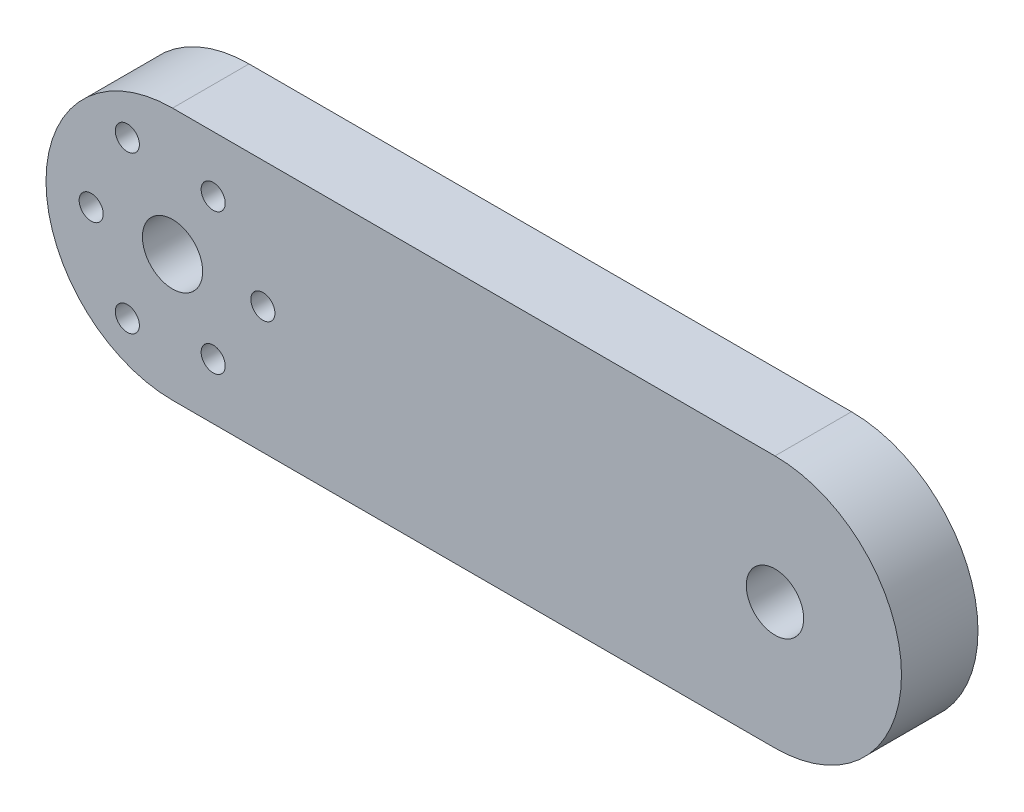
from build123d import *

# Parameters (mm, degrees)
SKETCH1_R           = 4.7625
SKETCH1_R_2         = 2
SKETCH1_R_3         = 5
BOSS_EXTRUDE2_DEPTH = 12.7


with BuildPart() as part:
    # Sketch1 → Boss-Extrude2 (new body)
    with BuildSketch(Plane.XY):
        with BuildLine():
            Line((0, 21), (100, 21))
            ThreePointArc((100, 21), (121, 0), (100, -21))
            Line((100, -21), (0, -21))
            ThreePointArc((0, -21), (-21, 0), (0, 21))
        make_face()
        with Locations((100, 0)):
            Circle(SKETCH1_R, mode=Mode.SUBTRACT)
        with Locations((15, 0)):
            Circle(SKETCH1_R_2, mode=Mode.SUBTRACT)
        with Locations((-7.5, -12.990381057)):
            Circle(SKETCH1_R_2, mode=Mode.SUBTRACT)
        with Locations((-7.5, 12.990381057)):
            Circle(SKETCH1_R_2, mode=Mode.SUBTRACT)
        Circle(SKETCH1_R_3, mode=Mode.SUBTRACT)
        with Locations((-13.5, 0)):
            Circle(SKETCH1_R_2, mode=Mode.SUBTRACT)
        with Locations((6.75, 11.691342951)):
            Circle(SKETCH1_R_2, mode=Mode.SUBTRACT)
        with Locations((6.75, -11.691342951)):
            Circle(SKETCH1_R_2, mode=Mode.SUBTRACT)
    extrude(amount=BOSS_EXTRUDE2_DEPTH)


solid = part.part
